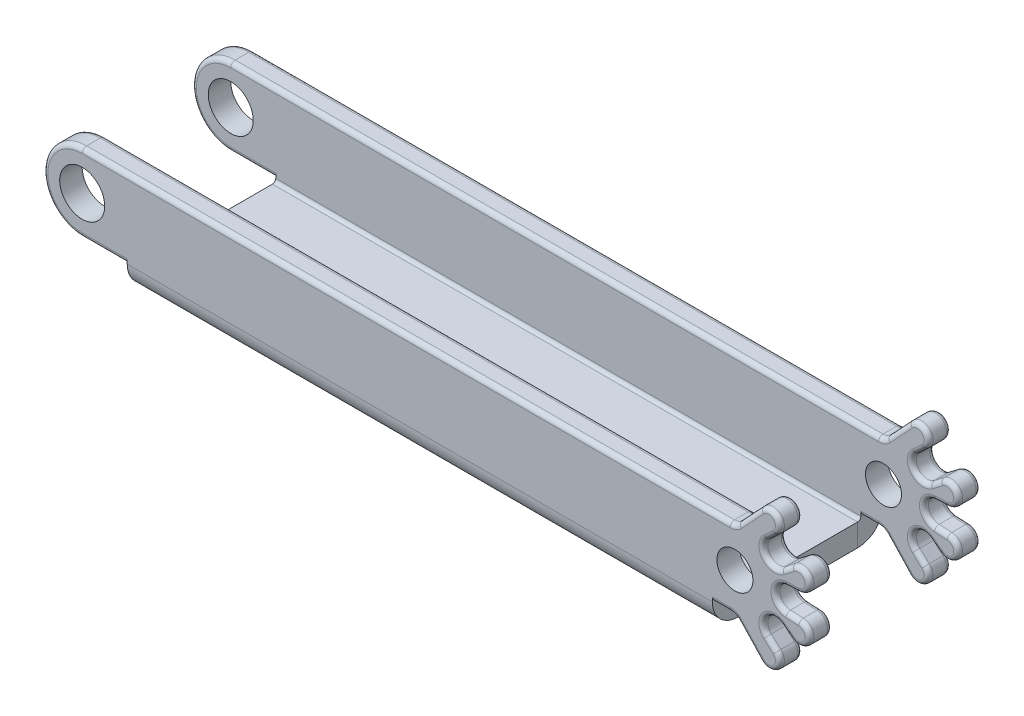
from build123d import *

# Parameters (mm, degrees)
SKETCH1_W                      = 130
SKETCH1_H                      = 38
BASE_FLANGE1_DEPTH             = 5
EDGE_FLANGE1_STRIP_W           = 21.4732
EDGE_FLANGE1_STRIP_H           = 5
EDGE_FLANGE1_STRIP_CUT_DEPTH   = 130
EDGE_FLANGE1_STRIP_2_W         = 21.4732
EDGE_FLANGE1_STRIP_2_H         = 5
EDGE_FLANGE1_STRIP_CUT_2_DEPTH = 130
EDGE_FLANGE1_DEPTH             = 130
EDGE_FLANGE1_BEND_DEPTH        = 130
SKETCH15_R                     = 5
BOSS_EXTRUDE1_DEPTH            = 5
BOSS_EXTRUDE2_DEPTH            = 5
SKETCH17_R                     = 4
CUT_EXTRUDE2_DEPTH             = 5
FILLET3_R                      = 2.5
FILLET4_R                      = 1


# Sheet-metal steps are written as plain solids
with BuildPart() as part:
    # Sketch1 → Base-Flange1 (new body)
    with BuildSketch(Plane(origin=(0, 0, 0), x_dir=(1, 0, 0), z_dir=(0, 1, 0))):
        Rectangle(SKETCH1_W, SKETCH1_H)
    extrude(amount=-BASE_FLANGE1_DEPTH)

    # Edge-Flange1 strip (across the edge) → Edge-Flange1 strip cut (cut)
    with BuildSketch(Plane(origin=(-65, 0, 19), x_dir=(0, 0, -1), z_dir=(1, 0, 0))):
        with Locations((-5, -2.5)):
            Rectangle(EDGE_FLANGE1_STRIP_W, EDGE_FLANGE1_STRIP_H)
    extrude(amount=EDGE_FLANGE1_STRIP_CUT_DEPTH, mode=Mode.SUBTRACT)

    # Edge-Flange1 strip 2 (across the edge) → Edge-Flange1 strip cut 2 (cut)
    with BuildSketch(Plane(origin=(65, 0, -19), x_dir=(0, 0, 1), z_dir=(-1, 0, 0))):
        with Locations((-5, -2.5)):
            Rectangle(EDGE_FLANGE1_STRIP_2_W, EDGE_FLANGE1_STRIP_2_H)
    extrude(amount=EDGE_FLANGE1_STRIP_CUT_2_DEPTH, mode=Mode.SUBTRACT)

    # Edge-Flange1 section (across the edge) → Edge-Flange1 (add)
    with BuildSketch(Plane(origin=(-65, 0, 19), x_dir=(0, 0, -1), z_dir=(1, 0, 0))):
        with BuildLine():
            Line((0, 0.7366), (0, 18))
            Line((0, 18), (5, 18))
            Line((5, 18), (5, 0.7366))
            ThreePointArc((5, 0.7366), (5.215745145, 0.215745145), (5.7366, 0))
            Line((5.7366, 0), (5.7366, -5))
            ThreePointArc((5.7366, -5), (1.680211239, -3.319788761), (0, 0.7366))
        make_face()
    extrude(amount=EDGE_FLANGE1_DEPTH)

    # Edge-Flange1 section 2 (across the edge) → Edge-Flange1 bend (add)
    with BuildSketch(Plane(origin=(65, 0, -19), x_dir=(0, 0, 1), z_dir=(-1, 0, 0))):
        with BuildLine():
            Line((0, 0.7366), (0, 18))
            Line((0, 18), (5, 18))
            Line((5, 18), (5, 0.7366))
            ThreePointArc((5, 0.7366), (5.215745145, 0.215745145), (5.7366, 0))
            Line((5.7366, 0), (5.7366, -5))
            ThreePointArc((5.7366, -5), (1.680211239, -3.319788761), (0, 0.7366))
        make_face()
    extrude(amount=EDGE_FLANGE1_BEND_DEPTH)

    # Sketch15 → Boss-Extrude1 (add)
    with BuildSketch(Plane.XY.offset(19)):
        with BuildLine():
            Line((-75, 18), (-65, 18))
            Line((-65, 18), (-65, 0.7366))
            Line((-65, 0.7366), (-75, 0.7366))
            ThreePointArc((-75, 0.7366), (-83.6317, 9.3683), (-75, 18))
        make_face()
        with Locations((-75, 9.3683)):
            Circle(SKETCH15_R, mode=Mode.SUBTRACT)
    boss_extrude1 = extrude(amount=-BOSS_EXTRUDE1_DEPTH)

    # Mirror3: Boss-Extrude1 across plane
    add(boss_extrude1.mirror(Plane.XY))

    # Sketch16 → Boss-Extrude2 (add)
    with BuildSketch(Plane.XY.offset(19)):
        with BuildLine():
            Line((65, 18), (70, 18))
            Line((70, 18), (75.674192261, 24.066435752))
            ThreePointArc((75.674192261, 24.066435752), (79.272990308, 24.121209175), (79.196919142, 20.52279832))
            Line((79.196919142, 20.52279832), (77.112591954, 18.596240249))
            ThreePointArc((77.112591954, 18.596240249), (76.894399988, 15.153388487), (80.322835732, 14.770420692))
            Line((80.322835732, 14.770420692), (82.582064675, 16.488538969))
            ThreePointArc((82.582064675, 16.488538969), (86.444620864, 15.353652508), (84.215222115, 12.001475782))
            Line((84.215222115, 12.001475782), (81.380167197, 11.865426368))
            ThreePointArc((81.380167197, 11.865426368), (79, 9.3683), (81.380167197, 6.871173632))
            Line((81.380167197, 6.871173632), (84.215222115, 6.735124218))
            ThreePointArc((84.215222115, 6.735124218), (86.444620864, 3.382947492), (82.582064675, 2.248061031))
            Line((82.582064675, 2.248061031), (80.322835732, 3.966179308))
            ThreePointArc((80.322835732, 3.966179308), (76.894399988, 3.583211513), (77.112591954, 0.140359751))
            Line((77.112591954, 0.140359751), (79.196919142, -1.78619832))
            ThreePointArc((79.196919142, -1.78619832), (79.272990308, -5.384609175), (75.674192261, -5.329835752))
            Line((75.674192261, -5.329835752), (70, 0.7366))
            Line((70, 0.7366), (65, 0.7366))
            Line((65, 0.7366), (65, 18))
        make_face()
    boss_extrude2 = extrude(amount=-BOSS_EXTRUDE2_DEPTH)

    # Sketch17 → Cut-Extrude2 (cut)
    with BuildSketch(Plane.XY.offset(19)):
        with Locations((70, 9.3683)):
            Circle(SKETCH17_R)
    cut_extrude2 = extrude(amount=-CUT_EXTRUDE2_DEPTH, mode=Mode.SUBTRACT)

    # Mirror5: Boss-Extrude2, Cut-Extrude2 across plane
    add(boss_extrude2.mirror(Plane.XY))
    add(cut_extrude2.mirror(Plane.XY), mode=Mode.SUBTRACT)

    # Fillet3
    fillet3_edges = [part.edges().sort_by_distance(p)[0] for p in [
        (70, 0.7366, 16.5),
        (70, 18, 16.5),
        (70, 0.7366, -16.5),
        (70, 18, -16.5),
    ]]
    fillet(fillet3_edges, radius=FILLET3_R)

    # Fillet4
    fillet4_edges = [part.edges().sort_by_distance(p)[0] for p in [
        (66.957606292, 0.7366, 14),
        (73.207606292, 21.429340528, 14),
        (79.272990308, 24.121209175, 14),
        (78.154755548, 19.559519284, 14),
        (76.894399988, 15.153388487, 14),
        (81.452450204, 15.629479831, 14),
        (86.444620864, 15.353652508, 14),
        (82.797694656, 11.933451075, 14),
        (79, 9.3683, 14),
        (82.797694656, 6.803148925, 14),
        (86.444620864, 3.382947492, 14),
        (81.452450204, 3.107120169, 14),
        (76.894399988, 3.583211513, 14),
        (78.154755548, -0.822919284, 14),
        (79.272990308, -5.384609175, 14),
        (79.272990308, -5.384609175, 19),
        (78.154755548, -0.822919284, 19),
        (76.894399988, 3.583211513, 19),
        (81.452450204, 3.107120169, 19),
        (86.444620864, 3.382947492, 19),
        (82.797694656, 6.803148925, 19),
        (79, 9.3683, 19),
        (82.797694656, 11.933451075, 19),
        (86.444620864, 15.353652508, 19),
        (81.452450204, 15.629479831, 19),
        (76.894399988, 15.153388487, 19),
        (78.154755548, 19.559519284, 19),
        (79.272990308, 24.121209175, 19),
        (73.207606292, 21.429340528, 19),
        (66.957606292, 0.7366, 19),
        (79.272990308, -5.384609175, -19),
        (78.154755548, -0.822919284, -19),
        (76.894399988, 3.583211513, -19),
        (81.452450204, 3.107120169, -19),
        (86.444620864, 3.382947492, -19),
        (82.797694656, 6.803148925, -19),
        (79, 9.3683, -19),
        (82.797694656, 11.933451075, -19),
        (86.444620864, 15.353652508, -19),
        (81.452450204, 15.629479831, -19),
        (76.894399988, 15.153388487, -19),
        (78.154755548, 19.559519284, -19),
        (79.272990308, 24.121209175, -19),
        (73.207606292, 21.429340528, -19),
        (66.957606292, 0.7366, -19),
        (79.272990308, -5.384609175, -14),
        (78.154755548, -0.822919284, -14),
        (76.894399988, 3.583211513, -14),
        (81.452450204, 3.107120169, -14),
        (86.444620864, 3.382947492, -14),
        (82.797694656, 6.803148925, -14),
        (79, 9.3683, -14),
        (82.797694656, 11.933451075, -14),
        (86.444620864, 15.353652508, -14),
        (81.452450204, 15.629479831, -14),
        (76.894399988, 15.153388487, -14),
        (78.154755548, 19.559519284, -14),
        (79.272990308, 24.121209175, -14),
        (73.207606292, 21.429340528, -14),
        (66.957606292, 0.7366, -14),
        (-3.042393708, 18, 14),
        (-3.042393708, 18, 19),
        (73.207606292, -2.692740528, 19),
        (73.207606292, -2.692740528, 14),
        (73.207606292, -2.692740528, -19),
        (73.207606292, -2.692740528, -14),
        (69.910354096, 18.206597861, 19),
        (69.910354096, 18.206597861, 14),
        (69.910354096, 0.530002139, 19),
        (69.910354096, 0.530002139, 14),
        (69.910354096, 0.530002139, -19),
        (69.910354096, 0.530002139, -14),
        (69.910354096, 18.206597861, -19),
        (69.910354096, 18.206597861, -14),
        (-3.042393708, 18, -19),
        (-3.042393708, 18, -14),
        (-70, 0.7366, 14),
        (-83.6317, 9.3683, 14),
        (-70, 0.7366, 19),
        (-83.6317, 9.3683, 19),
        (-70, 0.7366, -14),
        (-83.6317, 9.3683, -14),
        (-70, 0.7366, -19),
        (-83.6317, 9.3683, -19),
    ]]
    fillet(fillet4_edges, radius=FILLET4_R)


solid = part.part
